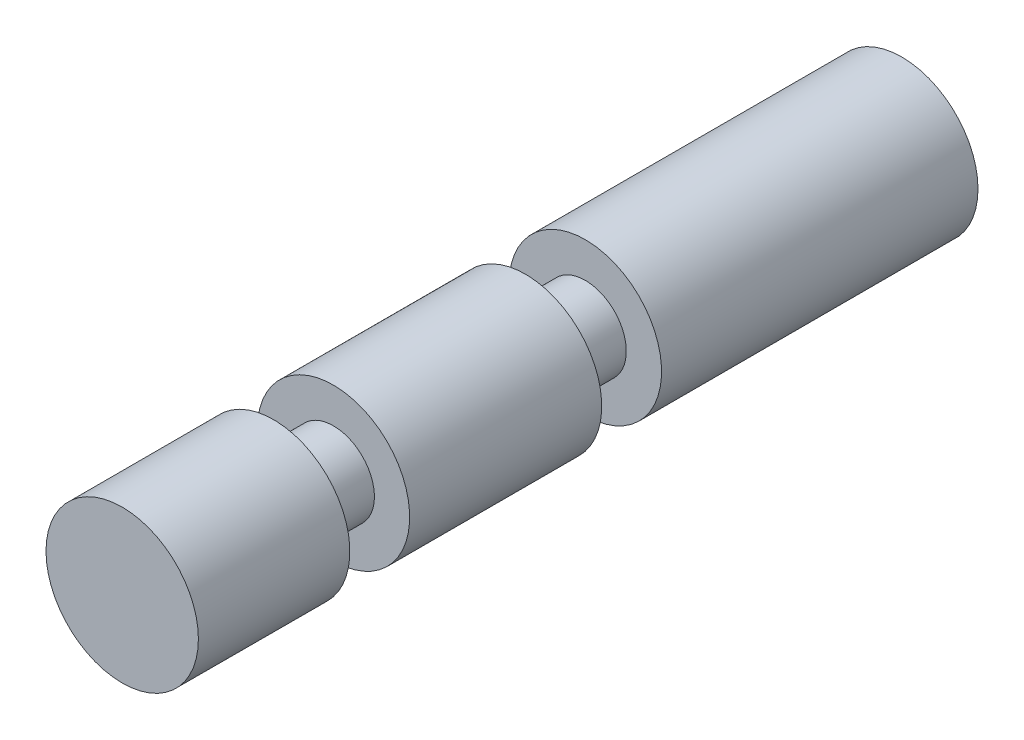
from build123d import *

# Parameters (mm, degrees)
SKETCH1_R           = 3.0734
BOSS_EXTRUDE1_DEPTH = 31.4452
SKETCH9_R           = 1.397
CUT_EXTRUDE3_DEPTH  = 7.62
SKETCH4_W           = 2.413
SKETCH4_H           = 1.4224
LPATTERN1_COUNT     = 2
LPATTERN1_PITCH     = 10.16


with BuildPart() as part:
    # Sketch1 → Boss-Extrude1 (new body)
    with BuildSketch(Plane.XY):
        Circle(SKETCH1_R)
    extrude(amount=BOSS_EXTRUDE1_DEPTH)

    # Sketch9 → Cut-Extrude3 (cut)
    with BuildSketch(Plane(origin=(0, 0, 0), x_dir=(-1, 0, 0), z_dir=(0, 0, -1))):
        Circle(SKETCH9_R)
    extrude(amount=-CUT_EXTRUDE3_DEPTH, mode=Mode.SUBTRACT)

    # Sketch4 → Cut-Revolve1 (revolve, cut)
    with BuildSketch(Plane(origin=(0, 0, 0), x_dir=(0, 0, -1), z_dir=(1, 0, 0))):
        with Locations((-13.97, 2.3622)):
            Rectangle(SKETCH4_W, SKETCH4_H)
    cut_revolve1 = revolve(axis=Axis((0, 0, 0), (0, 0, 1)), mode=Mode.SUBTRACT)

    # LPattern1: Cut-Revolve1 ×2
    with Locations(*[(0, 0, i * LPATTERN1_PITCH) for i in range(1, LPATTERN1_COUNT)]):
        add(cut_revolve1, mode=Mode.SUBTRACT)


solid = part.part
